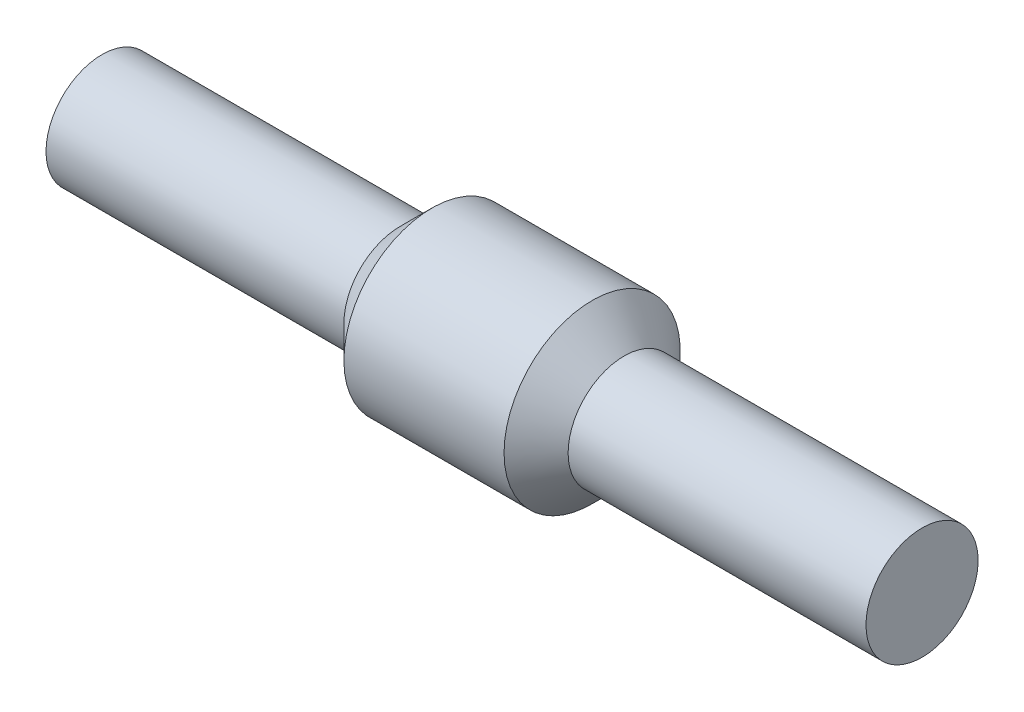
from build123d import *


with BuildPart() as part:
    # Sketch2 → Revolve1 (revolve)
    with BuildSketch(Plane.XY):
        Polygon((12.8, 0), (12.8, 1.75), (3.5, 1.75), (2.5, 2.75), (0, 2.75), (0, 0), align=None)
    revolve1 = revolve(axis=Axis((-20, 0, 0), (1, 0, 0)))

    # Mirror1: Revolve1 across plane
    add(revolve1.mirror(Plane(origin=(0, 0, 0), x_dir=(0, 0, 1), z_dir=(1, 0, 0))))


solid = part.part
